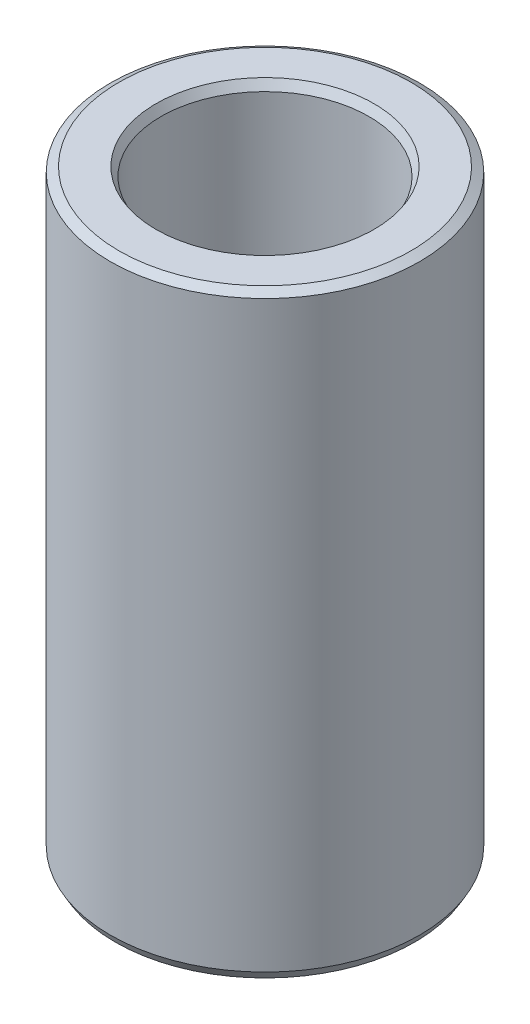
from build123d import *
from OCP.BRepFilletAPI import BRepFilletAPI_MakeChamfer

# Parameters (mm, degrees)
SKETCH1_R           = 35
BOSS_EXTRUDE1_DEPTH = 135.057837012
SKETCH2_R           = 23.534346387
CUT_EXTRUDE1_DEPTH  = 144.842341952
CHAMFER1_SIZE       = 1.129435026
CHAMFER1_SIZE2      = 1.956238848


with BuildPart() as part:
    # Sketch1 → Boss-Extrude1 (new body)
    with BuildSketch(Plane(origin=(0, 0, 0), x_dir=(1, 0, 0), z_dir=(0, 1, 0))):
        Circle(SKETCH1_R)
    extrude(amount=BOSS_EXTRUDE1_DEPTH)

    # Sketch2 → Cut-Extrude1 (cut, through all)
    with BuildSketch(Plane(origin=(0, 0, 0), x_dir=(1, 0, 0), z_dir=(0, 1, 0))):
        Circle(SKETCH2_R)
    extrude(amount=CUT_EXTRUDE1_DEPTH, mode=Mode.SUBTRACT)

    # Chamfer1: one chamfer whose edges measure the first distance from different faces: ONE call of the kernel's chamfer builder (chamfer() names one face for all edges)
    chamfer1_edges_1 = [part.edges().sort_by_distance(p)[0] for p in [
        (-23.534346387, 135.057837012, 0),
    ]]
    chamfer1_side_1 = [part.faces().sort_by_distance(p)[0] for p in [
        (-34.010050506, 135.057837012, 0),
    ]]
    chamfer1_edges_2 = [part.edges().sort_by_distance(p)[0] for p in [
        (-23.534346387, 0, 0),
    ]]
    chamfer1_side_2 = [part.faces().sort_by_distance(p)[0] for p in [
        (-23.534346387, 67.528918506, 0),
    ]]
    chamfer1_edges_3 = [part.edges().sort_by_distance(p)[0] for p in [
        (-35, 0, 0),
    ]]
    chamfer1_side_3 = [part.faces().sort_by_distance(p)[0] for p in [
        (-34.010050506, 0, 0),
    ]]
    chamfer1_edges_4 = [part.edges().sort_by_distance(p)[0] for p in [
        (-35, 135.057837012, 0),
    ]]
    chamfer1_side_4 = [part.faces().sort_by_distance(p)[0] for p in [
        (-35, 67.528918506, 0),
    ]]
    chamfer1 = BRepFilletAPI_MakeChamfer(part.part.solid().wrapped)
    for e in chamfer1_edges_1:
        chamfer1.Add(CHAMFER1_SIZE, CHAMFER1_SIZE2, e.wrapped, chamfer1_side_1[0].wrapped)  # the first distance lies on this face
    for e in chamfer1_edges_2:
        chamfer1.Add(CHAMFER1_SIZE, CHAMFER1_SIZE2, e.wrapped, chamfer1_side_2[0].wrapped)  # the first distance lies on this face
    for e in chamfer1_edges_3:
        chamfer1.Add(CHAMFER1_SIZE, CHAMFER1_SIZE2, e.wrapped, chamfer1_side_3[0].wrapped)  # the first distance lies on this face
    for e in chamfer1_edges_4:
        chamfer1.Add(CHAMFER1_SIZE, CHAMFER1_SIZE2, e.wrapped, chamfer1_side_4[0].wrapped)  # the first distance lies on this face
    add(Compound.cast(chamfer1.Shape()), mode=Mode.REPLACE)


solid = part.part
